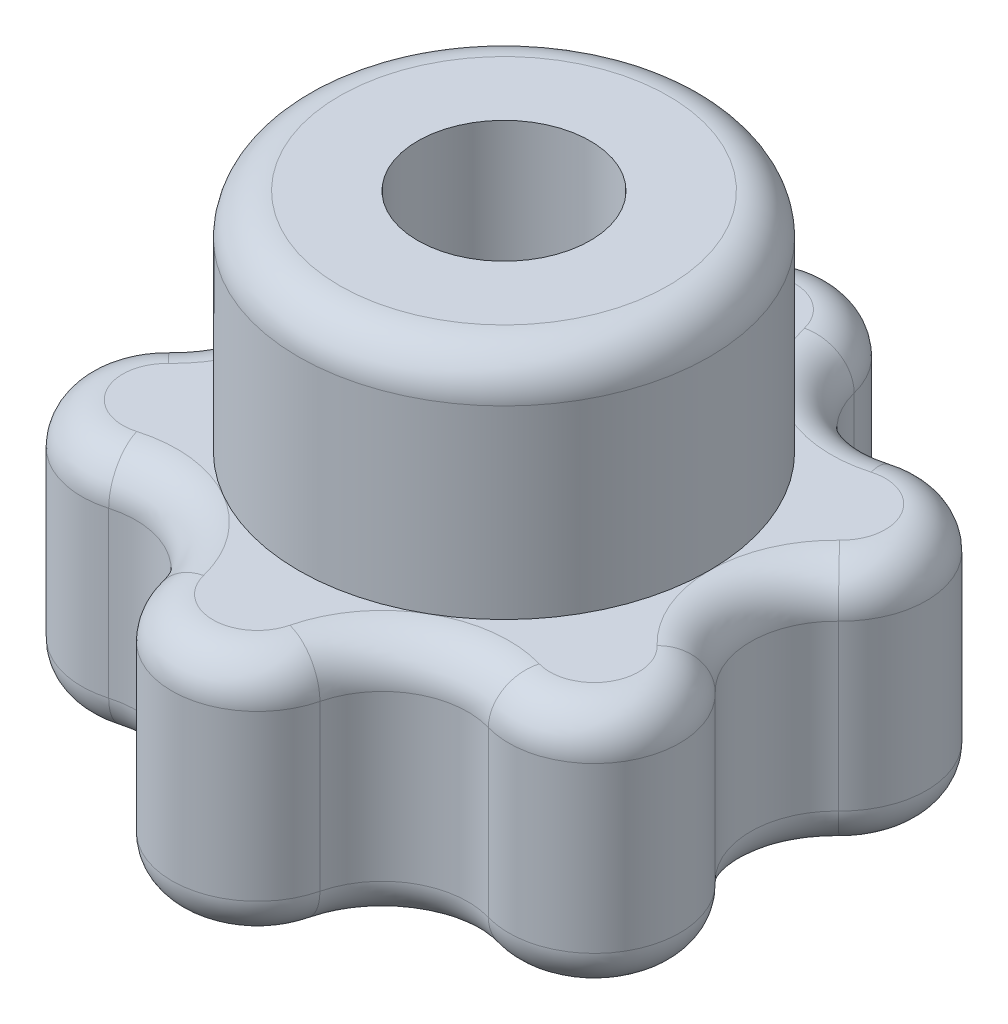
from build123d import *

# Parameters (mm, degrees)
EXTRUDE_1_DEPTH     = 6
SKETCH_2_R          = 5
EXTRUDE_2_DEPTH     = 5.5
SKETCH_3_R          = 2.1
CUT_EXTRUDE_1_DEPTH = 16.827501227
CUT_EXTRUDE_2_DEPTH = 3
FILLET_1_R          = 1


with BuildPart() as part:
    # Эскиз1 → Бобышка-Вытянуть1 (new body)
    with BuildSketch(Plane(origin=(0, 0, 0), x_dir=(1, 0, 0), z_dir=(0, 1, 0))):
        with BuildLine():
            ThreePointArc((2.020252334, 6.499179686), (0, 8.081009335), (-2.020252334, 6.499179686))
            ThreePointArc((-2.020252334, 6.499179686), (-3, 5.196152423), (-4.618328545, 4.999179686))
            ThreePointArc((-4.618328545, 4.999179686), (-6.998359372, 4.040504667), (-6.638580879, 1.5))
            ThreePointArc((-6.638580879, 1.5), (-6, 0), (-6.638580879, -1.5))
            ThreePointArc((-6.638580879, -1.5), (-6.998359372, -4.040504667), (-4.618328545, -4.999179686))
            ThreePointArc((-4.618328545, -4.999179686), (-3, -5.196152423), (-2.020252334, -6.499179686))
            ThreePointArc((-2.020252334, -6.499179686), (0, -8.081009335), (2.020252334, -6.499179686))
            ThreePointArc((2.020252334, -6.499179686), (3, -5.196152423), (4.618328545, -4.999179686))
            ThreePointArc((4.618328545, -4.999179686), (6.998359372, -4.040504667), (6.638580879, -1.5))
            ThreePointArc((6.638580879, -1.5), (6, 0), (6.638580879, 1.5))
            ThreePointArc((6.638580879, 1.5), (6.998359372, 4.040504667), (4.618328545, 4.999179686))
            ThreePointArc((4.618328545, 4.999179686), (3, 5.196152423), (2.020252334, 6.499179686))
        make_face()
    extrude(amount=EXTRUDE_1_DEPTH)

    # Эскиз2 → Бобышка-Вытянуть2 (add)
    with BuildSketch(Plane(origin=(0, 6, 0), x_dir=(1, 0, 0), z_dir=(0, 1, 0))):
        with Locations(Location((0, 0, 0), (0, 0, 270))):
            Circle(SKETCH_2_R)
    extrude(amount=EXTRUDE_2_DEPTH)

    # Эскиз3 → Вырез-Вытянуть1 (cut, through all)
    with BuildSketch(Plane(origin=(0, 11.5, 0), x_dir=(1, 0, 0), z_dir=(0, 1, 0))):
        with Locations(Location((0, 0, 0), (0, 0, 270))):
            Circle(SKETCH_3_R)
    extrude(amount=-CUT_EXTRUDE_1_DEPTH, mode=Mode.SUBTRACT)

    # Эскиз1<3> → Вырез-Вытянуть2 (cut)
    with BuildSketch(Plane(origin=(0, 0, 0), x_dir=(1, 0, 0), z_dir=(0, 1, 0))):
        Polygon((0, 4.214656965), (-3.65, 2.107328483), (-3.65, -2.107328483), (0, -4.214656965), (3.65, -2.107328483), (3.65, 2.107328483), align=None)
    extrude(amount=CUT_EXTRUDE_2_DEPTH, mode=Mode.SUBTRACT)

    # Скругление1
    fillet_1_edges = [part.edges().sort_by_distance(p)[0] for p in [
        (-3, 6, 5.196152423),
        (6.998359372, 0, 4.040504667),
        (6, 0, 0),
        (6.998359372, 0, -4.040504667),
        (3, 0, -5.196152423),
        (0, 0, -8.081009335),
        (-3, 0, -5.196152423),
        (-6.998359372, 6, 4.040504667),
        (-6.998359372, 0, -4.040504667),
        (-6, 0, 0),
        (-6.998359372, 0, 4.040504667),
        (-3, 0, 5.196152423),
        (0, 0, 8.081009335),
        (3, 0, 5.196152423),
        (-6, 6, 0),
        (-6.998359372, 6, -4.040504667),
        (-3, 6, -5.196152423),
        (0, 6, -8.081009335),
        (3, 6, -5.196152423),
        (6.998359372, 6, -4.040504667),
        (6, 6, 0),
        (0, 11.5, -5),
        (6.998359372, 6, 4.040504667),
        (3, 6, 5.196152423),
        (0, 6, 8.081009335),
    ]]
    fillet(fillet_1_edges, radius=FILLET_1_R - 0.0001)  # a hair under: the kernel refuses the full size


solid = part.part
